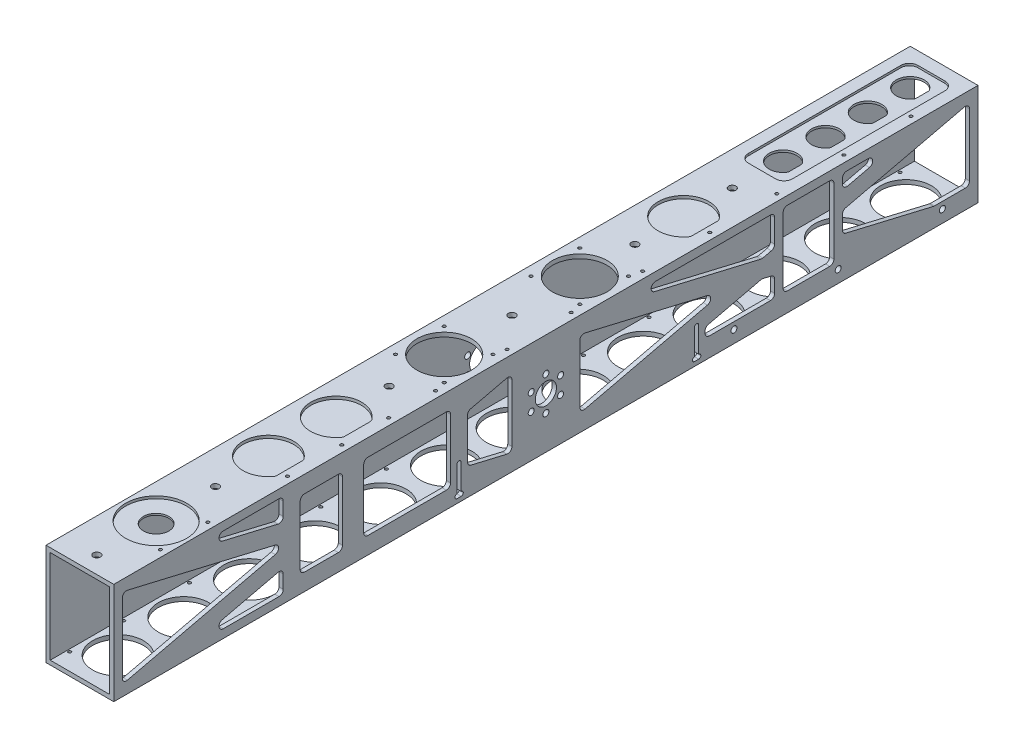
from build123d import *

# Parameters (mm, degrees)
SKETCH1_W                   = 50.8
SKETCH1_H                   = 76.2
SKETCH1_W_2                 = 44.45
SKETCH1_H_2                 = 69.85
BOSS_EXTRUDE1_DEPTH         = 647.7
CUT_EXTRUDE1_DEPTH          = 655.142469192
SKETCH4_R                   = 7.9375
CUT_EXTRUDE3_DEPTH          = 655.142469192
CUT_EXTRUDE4_REACH          = 656.142
SKETCH5_R                   = 9.525
F_8_CLEARANCE_HOLE1_D       = 4.4958
CIRPATTERN1_COUNT           = 6
SKETCH10_W                  = 57.15
SKETCH10_H                  = 76.2
BOSS_EXTRUDE2_DEPTH         = 3.175
CUT_EXTRUDE5_REACH          = 656.142
SKETCH12_R                  = 20.447
F_4_40_TAPPED_HOLE1_D       = 2.2606
F_4_40_TAPPED_HOLE1_DEPTH   = 3.175
CUT_EXTRUDE6_REACH          = 656.142
SKETCH17_W                  = 31.75
SKETCH17_H                  = 50.8
CUT_EXTRUDE7_REACH          = 656.142
LPATTERN1_COUNT             = 4
LPATTERN1_PITCH             = 31.75
CUT_EXTRUDE8_DEPTH          = 1.5875
F_1_4_28_TAPPED_HOLE2_D     = 5.4102
F_1_4_28_TAPPED_HOLE2_DEPTH = 3.175
CUT_EXTRUDE9_REACH          = 656.142
SKETCH23_R                  = 19.05
CUT_EXTRUDE10_REACH         = 656.142
SKETCH24_R                  = 19.05
BOSS_EXTRUDE3_DEPTH         = 3.175
BOSS_EXTRUDE6_DEPTH         = 3.175
CUT_EXTRUDE13_REACH         = 656.142
FILLET2_R                   = 1.5875
LPATTERN2_COUNT             = 2
LPATTERN2_PITCH             = 178.054
FILLET2_OF_LPATTERN2_R      = 1.5875
FILLET3_R                   = 3.175
SKETCH32_W                  = 204.5335
SKETCH32_H                  = 14.2875
BOSS_EXTRUDE7_DEPTH         = 3.175
FILLET4_R                   = 3.175
F_8_CLEARANCE_HOLE2_D       = 4.4958
F_8_CLEARANCE_HOLE2_DEPTH   = 3.175
SKETCH38_W                  = 254
SKETCH38_H                  = 14.2875
BOSS_EXTRUDE8_DEPTH         = 3.175
FILLET5_R                   = 3.175
F_8_CLEARANCE_HOLE3_D       = 4.4958
F_8_CLEARANCE_HOLE3_DEPTH   = 3.302
F_8_CLEARANCE_HOLE3_TIP     = 1.350674586
SKETCH41_W                  = 68.2625
SKETCH41_H                  = 76.2
BOSS_EXTRUDE9_DEPTH         = 3.175
CUT_EXTRUDE14_REACH         = 656.142
SKETCH43_W                  = 50.8
SKETCH43_H                  = 61.9125
BOSS_EXTRUDE10_DEPTH        = 3.175
FILLET6_R                   = 3.175
CUT_EXTRUDE15_REACH         = 656.142
SKETCH45_R                  = 19.05
BOSS_EXTRUDE12_DEPTH        = 3.175
SKETCH46_R                  = 22.86
CUT_EXTRUDE16_DEPTH         = 1.905
CUT_EXTRUDE17_REACH         = 655.923
SKETCH47_R                  = 9.525
BOSS_EXTRUDE13_DEPTH        = 1.016
F_4_40_TAPPED_HOLE2_D       = 2.2606
F_4_40_TAPPED_HOLE2_DEPTH   = 7.62
F_4_40_TAPPED_HOLE2_TIP     = 0.679152758
BOSS_EXTRUDE14_DEPTH        = 3.175
BOSS_EXTRUDE15_START        = -1.016
BOSS_EXTRUDE15_DEPTH        = 1.016
FILLET7_R                   = 3.175
F_4_40_TAPPED_HOLE3_D       = 2.2606
F_4_40_TAPPED_HOLE3_DEPTH   = 3.175


with BuildPart() as part:
    # Sketch1 → Boss-Extrude1 (new body)
    with BuildSketch(Plane.XY):
        with Locations((25.4, 38.1)):
            Rectangle(SKETCH1_W, SKETCH1_H)
        with Locations((25.4, 38.1)):
            Rectangle(SKETCH1_W_2, SKETCH1_H_2, mode=Mode.SUBTRACT)
    extrude(amount=BOSS_EXTRUDE1_DEPTH)

    # Sketch2 → Cut-Extrude1 (cut, through all)
    with BuildSketch(Plane(origin=(50.8, 0, 0), x_dir=(0, 0, -1), z_dir=(1, 0, 0))):
        with BuildLine():
            ThreePointArc((-566.359206485, 63.584400491), (-568.785835896, 67.041040679), (-565.632006601, 69.85))
            Line((-565.632006601, 69.85), (-405.917993399, 69.85))
            ThreePointArc((-405.917993399, 69.85), (-402.764164104, 67.041040679), (-405.190793515, 63.584400491))
            Line((-405.190793515, 63.584400491), (-485.047800115, 44.794516585))
            ThreePointArc((-485.047800115, 44.794516585), (-485.775, 44.710116094), (-486.502199885, 44.794516585))
            Line((-486.502199885, 44.794516585), (-566.359206485, 63.584400491))
        make_face()
        with BuildLine():
            Line((-637.447800115, 8.935693055), (-526.634543515, 35.009400491))
            ThreePointArc((-526.634543515, 35.009400491), (-524.186743399, 38.1), (-526.634543515, 41.190599509))
            Line((-526.634543515, 41.190599509), (-637.447800115, 67.264306945))
            ThreePointArc((-637.447800115, 67.264306945), (-640.146264235, 66.662631363), (-641.35, 64.173707435))
            Line((-641.35, 64.173707435), (-641.35, 12.026292565))
            ThreePointArc((-641.35, 12.026292565), (-640.146264235, 9.537368637), (-637.447800115, 8.935693055))
        make_face()
        with BuildLine():
            Line((-485.047800115, 31.405483415), (-405.190793515, 12.615599509))
            ThreePointArc((-405.190793515, 12.615599509), (-402.764164104, 9.158959321), (-405.917993399, 6.35))
            Line((-405.917993399, 6.35), (-565.632006601, 6.35))
            ThreePointArc((-565.632006601, 6.35), (-568.785835896, 9.158959321), (-566.359206485, 12.615599509))
            Line((-566.359206485, 12.615599509), (-486.502199885, 31.405483415))
            ThreePointArc((-486.502199885, 31.405483415), (-485.775, 31.489883906), (-485.047800115, 31.405483415))
        make_face()
        with BuildLine():
            ThreePointArc((-444.915456485, 35.009400491), (-447.363256601, 38.1), (-444.915456485, 41.190599509))
            Line((-444.915456485, 41.190599509), (-353.152199885, 62.781954004))
            ThreePointArc((-353.152199885, 62.781954004), (-350.453735765, 62.180278422), (-349.25, 59.691354494))
            Line((-349.25, 59.691354494), (-349.25, 16.508645506))
            ThreePointArc((-349.25, 16.508645506), (-350.453735765, 14.019721578), (-353.152199885, 13.418045996))
            Line((-353.152199885, 13.418045996), (-444.915456485, 35.009400491))
        make_face()
        with BuildLine():
            Line((-294.547800115, 62.781954004), (-202.784543515, 41.190599509))
            ThreePointArc((-202.784543515, 41.190599509), (-200.336743399, 38.1), (-202.784543515, 35.009400491))
            Line((-202.784543515, 35.009400491), (-294.547800115, 13.418045996))
            ThreePointArc((-294.547800115, 13.418045996), (-297.246264235, 14.019721578), (-298.45, 16.508645506))
            Line((-298.45, 16.508645506), (-298.45, 59.691354494))
            ThreePointArc((-298.45, 59.691354494), (-297.246264235, 62.180278422), (-294.547800115, 62.781954004))
        make_face()
        with BuildLine():
            ThreePointArc((-161.197800115, 44.794516585), (-161.925, 44.710116094), (-162.652199885, 44.794516585))
            Line((-162.652199885, 44.794516585), (-242.509206485, 63.584400491))
            ThreePointArc((-242.509206485, 63.584400491), (-244.935835896, 67.041040679), (-241.782006601, 69.85))
            Line((-241.782006601, 69.85), (-82.067993399, 69.85))
            ThreePointArc((-82.067993399, 69.85), (-78.914164104, 67.041040679), (-81.340793515, 63.584400491))
            Line((-81.340793515, 63.584400491), (-161.197800115, 44.794516585))
        make_face()
        with BuildLine():
            Line((-161.197800115, 31.405483415), (-81.340793515, 12.615599509))
            ThreePointArc((-81.340793515, 12.615599509), (-78.914164104, 9.158959321), (-82.067993399, 6.35))
            Line((-82.067993399, 6.35), (-241.782006601, 6.35))
            ThreePointArc((-241.782006601, 6.35), (-244.935835896, 9.158959321), (-242.509206485, 12.615599509))
            Line((-242.509206485, 12.615599509), (-162.652199885, 31.405483415))
            ThreePointArc((-162.652199885, 31.405483415), (-161.925, 31.489883906), (-161.197800115, 31.405483415))
        make_face()
        with BuildLine():
            Line((-121.065456485, 41.190599509), (-10.252199885, 67.264306945))
            ThreePointArc((-10.252199885, 67.264306945), (-7.553735765, 66.662631363), (-6.35, 64.173707435))
            Line((-6.35, 64.173707435), (-6.35, 12.026292565))
            ThreePointArc((-6.35, 12.026292565), (-7.553735765, 9.537368637), (-10.252199885, 8.935693055))
            Line((-10.252199885, 8.935693055), (-121.065456485, 35.009400491))
            ThreePointArc((-121.065456485, 35.009400491), (-123.513256601, 38.1), (-121.065456485, 41.190599509))
        make_face()
    extrude(amount=-CUT_EXTRUDE1_DEPTH, mode=Mode.SUBTRACT)

    # Sketch4 → Cut-Extrude3 (cut, through all)
    with BuildSketch(Plane(origin=(50.8, 0, 0), x_dir=(0, 0, -1), z_dir=(1, 0, 0))):
        with Locations((-323.85, 38.1)):
            Circle(SKETCH4_R)
    extrude(amount=-CUT_EXTRUDE3_DEPTH, mode=Mode.SUBTRACT)

    # Sketch5 → Cut-Extrude4 (cut, up to next)
    with BuildSketch(Plane.ZY, mode=Mode.PRIVATE) as cut_extrude4_sk1:
        with Locations((323.85, 38.1)):
            Circle(SKETCH5_R)
    cut_extrude4_tool1 = extrude(cut_extrude4_sk1.sketch, amount=-CUT_EXTRUDE4_REACH, mode=Mode.PRIVATE) & part.part
    add(cut_extrude4_tool1.solids().sort_by_distance((0, 38.1, 323.85))[0], mode=Mode.SUBTRACT)

    # #8 Clearance Hole1 (through all)
    with Locations(Plane.ZY):
        with Locations((323.85, 50.8)):
            f_8_clearance_hole1 = Hole(F_8_CLEARANCE_HOLE1_D / 2)

    # CirPattern1: #8 Clearance Hole1 ×6 about axis
    cirpattern1_axis = Axis((0, 38.1, 323.85), (1, 0, 0))
    for i in range(1, CIRPATTERN1_COUNT):
        add(f_8_clearance_hole1.rotate(cirpattern1_axis, i * 360 / CIRPATTERN1_COUNT), mode=Mode.SUBTRACT)

    # Sketch10 → Boss-Extrude2 (add)
    with BuildSketch(Plane(origin=(50.8, 0, 0), x_dir=(0, 0, -1), z_dir=(1, 0, 0))):
        with Locations((-492.125, 38.1)):
            Rectangle(SKETCH10_W, SKETCH10_H)
    extrude(amount=-BOSS_EXTRUDE2_DEPTH)

    # Sketch12 → Cut-Extrude5 (cut, up to next)
    with BuildSketch(Plane(origin=(0, 76.2, 0), x_dir=(1, 0, 0), z_dir=(0, 1, 0)), mode=Mode.PRIVATE) as cut_extrude5_sk1:
        with Locations(Location((25.4, -273.05, 0), (0, 0, 270))):
            Circle(SKETCH12_R)
    cut_extrude5_tool1 = extrude(cut_extrude5_sk1.sketch, amount=-CUT_EXTRUDE5_REACH, mode=Mode.PRIVATE) & part.part
    # Sketch12 → Cut-Extrude5 (cut, up to next)
    with BuildSketch(Plane(origin=(0, 76.2, 0), x_dir=(1, 0, 0), z_dir=(0, 1, 0)), mode=Mode.PRIVATE) as cut_extrude5_sk2:
        with Locations(Location((25.4, -374.65, 0), (0, 0, 270))):
            Circle(SKETCH12_R)
    cut_extrude5_tool2 = extrude(cut_extrude5_sk2.sketch, amount=-CUT_EXTRUDE5_REACH, mode=Mode.PRIVATE) & part.part
    add(cut_extrude5_tool1.solids().sort_by_distance((25.4, 76.2, 273.05))[0], mode=Mode.SUBTRACT)
    add(cut_extrude5_tool2.solids().sort_by_distance((25.4, 76.2, 374.65))[0], mode=Mode.SUBTRACT)

    # #4-40 Tapped Hole1
    with Locations(Plane(origin=(0, 76.2, 0), x_dir=(-1, 0, 0), z_dir=(0, 1, 0))):
        with Locations((-7.1374, 254.7874), (-43.6626, 254.7874), (-43.6626, 291.3126), (-7.1374, 291.3126), (-7.1374, 356.3874), (-43.6626, 356.3874), (-7.1374, 392.9126), (-43.6626, 392.9126)):
            Hole(F_4_40_TAPPED_HOLE1_D / 2, depth=F_4_40_TAPPED_HOLE1_DEPTH)

    # Sketch17 → Cut-Extrude6 (cut, up to next)
    with BuildSketch(Plane(origin=(50.8, 0, 0), x_dir=(0, 0, -1), z_dir=(1, 0, 0)), mode=Mode.PRIVATE) as cut_extrude6_sk1:
        with Locations((-492.125, 38.1)):
            Rectangle(SKETCH17_W, SKETCH17_H)
    cut_extrude6_tool1 = extrude(cut_extrude6_sk1.sketch, amount=-CUT_EXTRUDE6_REACH, mode=Mode.PRIVATE) & part.part
    add(cut_extrude6_tool1.solids().sort_by_distance((50.8, 38.1, 492.125))[0], mode=Mode.SUBTRACT)

    # Sketch18 → Cut-Extrude7 (cut, up to next)
    with BuildSketch(Plane(origin=(0, 76.2, 0), x_dir=(1, 0, 0), z_dir=(0, 1, 0)), mode=Mode.PRIVATE) as cut_extrude7_sk1:
        with BuildLine():
            Line((34.4043, -115.443309765), (34.4043, -125.856690235))
            ThreePointArc((34.4043, -125.856690235), (14.9987, -120.65), (34.4043, -115.443309765))
        make_face()
    cut_extrude7_tool1 = extrude(cut_extrude7_sk1.sketch, amount=-CUT_EXTRUDE7_REACH, mode=Mode.PRIVATE) & part.part
    cut_extrude7 = cut_extrude7_tool1.solids().sort_by_distance((25.114883, 76.2, 120.65))[0]
    add(cut_extrude7, mode=Mode.SUBTRACT)

    # LPattern1: Cut-Extrude7 ×4
    with Locations(*[(0, 0, -i * LPATTERN1_PITCH) for i in range(1, LPATTERN1_COUNT)]):
        add(cut_extrude7, mode=Mode.SUBTRACT)

    # Sketch19 → Cut-Extrude8 (cut)
    with BuildSketch(Plane(origin=(0, 76.2, 0), x_dir=(1, 0, 0), z_dir=(0, 1, 0))):
        with BuildLine():
            Line((15.24, -9.525), (35.56, -9.525))
            ThreePointArc((35.56, -9.525), (40.050128061, -11.384871939), (41.91, -15.875))
            Line((41.91, -15.875), (41.91, -130.175))
            ThreePointArc((41.91, -130.175), (40.050128061, -134.665128061), (35.56, -136.525))
            Line((35.56, -136.525), (15.24, -136.525))
            ThreePointArc((15.24, -136.525), (10.749871939, -134.665128061), (8.89, -130.175))
            Line((8.89, -130.175), (8.89, -15.875))
            ThreePointArc((8.89, -15.875), (10.749871939, -11.384871939), (15.24, -9.525))
        make_face()
    extrude(amount=-CUT_EXTRUDE8_DEPTH, mode=Mode.SUBTRACT)

    # 1/4-28 Tapped Hole2
    with Locations(Plane(origin=(0, 76.2, 0), x_dir=(-1, 0, 0), z_dir=(0, 1, 0))):
        with Locations((-25.4, 158.75), (-25.4, 231.775), (-25.4, 323.85), (-25.4, 415.925), (-25.4, 546.1), (-25.4, 635)):
            Hole(F_1_4_28_TAPPED_HOLE2_D / 2, depth=F_1_4_28_TAPPED_HOLE2_DEPTH)

    # Sketch23 → Cut-Extrude9 (cut, up to next)
    with BuildSketch(Plane(origin=(0, 76.2, 0), x_dir=(1, 0, 0), z_dir=(0, 1, 0)), mode=Mode.PRIVATE) as cut_extrude9_sk1:
        with Locations(Location((25.4, -195.2625, 0), (0, 0, 270))):
            Circle(SKETCH23_R)
    cut_extrude9_tool1 = extrude(cut_extrude9_sk1.sketch, amount=-CUT_EXTRUDE9_REACH, mode=Mode.PRIVATE) & part.part
    # Sketch23 → Cut-Extrude9 (cut, up to next)
    with BuildSketch(Plane(origin=(0, 76.2, 0), x_dir=(1, 0, 0), z_dir=(0, 1, 0)), mode=Mode.PRIVATE) as cut_extrude9_sk2:
        with Locations(Location((25.4, -455.6125, 0), (0, 0, 270))):
            Circle(SKETCH23_R)
    cut_extrude9_tool2 = extrude(cut_extrude9_sk2.sketch, amount=-CUT_EXTRUDE9_REACH, mode=Mode.PRIVATE) & part.part
    # Sketch23 → Cut-Extrude9 (cut, up to next)
    with BuildSketch(Plane(origin=(0, 76.2, 0), x_dir=(1, 0, 0), z_dir=(0, 1, 0)), mode=Mode.PRIVATE) as cut_extrude9_sk3:
        with Locations(Location((25.4, -506.4125, 0), (0, 0, 270))):
            Circle(SKETCH23_R)
    cut_extrude9_tool3 = extrude(cut_extrude9_sk3.sketch, amount=-CUT_EXTRUDE9_REACH, mode=Mode.PRIVATE) & part.part
    # Sketch23 → Cut-Extrude9 (cut, up to next)
    with BuildSketch(Plane(origin=(0, 76.2, 0), x_dir=(1, 0, 0), z_dir=(0, 1, 0)), mode=Mode.PRIVATE) as cut_extrude9_sk4:
        with Locations(Location((25.4, -590.55, 0), (0, 0, 270))):
            Circle(SKETCH23_R)
    cut_extrude9_tool4 = extrude(cut_extrude9_sk4.sketch, amount=-CUT_EXTRUDE9_REACH, mode=Mode.PRIVATE) & part.part
    add(cut_extrude9_tool1.solids().sort_by_distance((25.4, 76.2, 195.2625))[0], mode=Mode.SUBTRACT)
    add(cut_extrude9_tool2.solids().sort_by_distance((25.4, 76.2, 455.6125))[0], mode=Mode.SUBTRACT)
    add(cut_extrude9_tool3.solids().sort_by_distance((25.4, 76.2, 506.4125))[0], mode=Mode.SUBTRACT)
    add(cut_extrude9_tool4.solids().sort_by_distance((25.4, 76.2, 590.55))[0], mode=Mode.SUBTRACT)

    # Sketch24 → Cut-Extrude10 (cut, up to next)
    with BuildSketch(Plane.XZ, mode=Mode.PRIVATE) as cut_extrude10_sk1:
        with Locations(Location((25.4, 619.125, 0), (0, 0, 270))):
            Circle(SKETCH24_R)
    cut_extrude10_tool1 = extrude(cut_extrude10_sk1.sketch, amount=-CUT_EXTRUDE10_REACH, mode=Mode.PRIVATE) & part.part
    # Sketch24 → Cut-Extrude10 (cut, up to next)
    with BuildSketch(Plane.XZ, mode=Mode.PRIVATE) as cut_extrude10_sk2:
        with Locations(Location((25.4, 569.9125, 0), (0, 0, 270))):
            Circle(SKETCH24_R)
    cut_extrude10_tool2 = extrude(cut_extrude10_sk2.sketch, amount=-CUT_EXTRUDE10_REACH, mode=Mode.PRIVATE) & part.part
    # Sketch24 → Cut-Extrude10 (cut, up to next)
    with BuildSketch(Plane.XZ, mode=Mode.PRIVATE) as cut_extrude10_sk3:
        with Locations(Location((25.4, 520.7, 0), (0, 0, 270))):
            Circle(SKETCH24_R)
    cut_extrude10_tool3 = extrude(cut_extrude10_sk3.sketch, amount=-CUT_EXTRUDE10_REACH, mode=Mode.PRIVATE) & part.part
    # Sketch24 → Cut-Extrude10 (cut, up to next)
    with BuildSketch(Plane.XZ, mode=Mode.PRIVATE) as cut_extrude10_sk4:
        with Locations(Location((25.4, 471.4875, 0), (0, 0, 270))):
            Circle(SKETCH24_R)
    cut_extrude10_tool4 = extrude(cut_extrude10_sk4.sketch, amount=-CUT_EXTRUDE10_REACH, mode=Mode.PRIVATE) & part.part
    # Sketch24 → Cut-Extrude10 (cut, up to next)
    with BuildSketch(Plane.XZ, mode=Mode.PRIVATE) as cut_extrude10_sk5:
        with Locations(Location((25.4, 422.275, 0), (0, 0, 270))):
            Circle(SKETCH24_R)
    cut_extrude10_tool5 = extrude(cut_extrude10_sk5.sketch, amount=-CUT_EXTRUDE10_REACH, mode=Mode.PRIVATE) & part.part
    # Sketch24 → Cut-Extrude10 (cut, up to next)
    with BuildSketch(Plane.XZ, mode=Mode.PRIVATE) as cut_extrude10_sk6:
        with Locations(Location((25.4, 373.0625, 0), (0, 0, 270))):
            Circle(SKETCH24_R)
    cut_extrude10_tool6 = extrude(cut_extrude10_sk6.sketch, amount=-CUT_EXTRUDE10_REACH, mode=Mode.PRIVATE) & part.part
    # Sketch24 → Cut-Extrude10 (cut, up to next)
    with BuildSketch(Plane.XZ, mode=Mode.PRIVATE) as cut_extrude10_sk7:
        with Locations(Location((25.4, 323.85, 0), (0, 0, 270))):
            Circle(SKETCH24_R)
    cut_extrude10_tool7 = extrude(cut_extrude10_sk7.sketch, amount=-CUT_EXTRUDE10_REACH, mode=Mode.PRIVATE) & part.part
    # Sketch24 → Cut-Extrude10 (cut, up to next)
    with BuildSketch(Plane.XZ, mode=Mode.PRIVATE) as cut_extrude10_sk8:
        with Locations(Location((25.4, 274.6375, 0), (0, 0, 270))):
            Circle(SKETCH24_R)
    cut_extrude10_tool8 = extrude(cut_extrude10_sk8.sketch, amount=-CUT_EXTRUDE10_REACH, mode=Mode.PRIVATE) & part.part
    # Sketch24 → Cut-Extrude10 (cut, up to next)
    with BuildSketch(Plane.XZ, mode=Mode.PRIVATE) as cut_extrude10_sk9:
        with Locations(Location((25.4, 225.425, 0), (0, 0, 270))):
            Circle(SKETCH24_R)
    cut_extrude10_tool9 = extrude(cut_extrude10_sk9.sketch, amount=-CUT_EXTRUDE10_REACH, mode=Mode.PRIVATE) & part.part
    # Sketch24 → Cut-Extrude10 (cut, up to next)
    with BuildSketch(Plane.XZ, mode=Mode.PRIVATE) as cut_extrude10_sk10:
        with Locations(Location((25.4, 176.2125, 0), (0, 0, 270))):
            Circle(SKETCH24_R)
    cut_extrude10_tool10 = extrude(cut_extrude10_sk10.sketch, amount=-CUT_EXTRUDE10_REACH, mode=Mode.PRIVATE) & part.part
    # Sketch24 → Cut-Extrude10 (cut, up to next)
    with BuildSketch(Plane.XZ, mode=Mode.PRIVATE) as cut_extrude10_sk11:
        with Locations(Location((25.4, 127, 0), (0, 0, 270))):
            Circle(SKETCH24_R)
    cut_extrude10_tool11 = extrude(cut_extrude10_sk11.sketch, amount=-CUT_EXTRUDE10_REACH, mode=Mode.PRIVATE) & part.part
    # Sketch24 → Cut-Extrude10 (cut, up to next)
    with BuildSketch(Plane.XZ, mode=Mode.PRIVATE) as cut_extrude10_sk12:
        with Locations(Location((25.4, 77.7875, 0), (0, 0, 270))):
            Circle(SKETCH24_R)
    cut_extrude10_tool12 = extrude(cut_extrude10_sk12.sketch, amount=-CUT_EXTRUDE10_REACH, mode=Mode.PRIVATE) & part.part
    # Sketch24 → Cut-Extrude10 (cut, up to next)
    with BuildSketch(Plane.XZ, mode=Mode.PRIVATE) as cut_extrude10_sk13:
        with Locations(Location((25.4, 28.575, 0), (0, 0, 270))):
            Circle(SKETCH24_R)
    cut_extrude10_tool13 = extrude(cut_extrude10_sk13.sketch, amount=-CUT_EXTRUDE10_REACH, mode=Mode.PRIVATE) & part.part
    add(cut_extrude10_tool1.solids().sort_by_distance((25.4, 0, 619.125))[0], mode=Mode.SUBTRACT)
    add(cut_extrude10_tool2.solids().sort_by_distance((25.4, 0, 569.9125))[0], mode=Mode.SUBTRACT)
    add(cut_extrude10_tool3.solids().sort_by_distance((25.4, 0, 520.7))[0], mode=Mode.SUBTRACT)
    add(cut_extrude10_tool4.solids().sort_by_distance((25.4, 0, 471.4875))[0], mode=Mode.SUBTRACT)
    add(cut_extrude10_tool5.solids().sort_by_distance((25.4, 0, 422.275))[0], mode=Mode.SUBTRACT)
    add(cut_extrude10_tool6.solids().sort_by_distance((25.4, 0, 373.0625))[0], mode=Mode.SUBTRACT)
    add(cut_extrude10_tool7.solids().sort_by_distance((25.4, 0, 323.85))[0], mode=Mode.SUBTRACT)
    add(cut_extrude10_tool8.solids().sort_by_distance((25.4, 0, 274.6375))[0], mode=Mode.SUBTRACT)
    add(cut_extrude10_tool9.solids().sort_by_distance((25.4, 0, 225.425))[0], mode=Mode.SUBTRACT)
    add(cut_extrude10_tool10.solids().sort_by_distance((25.4, 0, 176.2125))[0], mode=Mode.SUBTRACT)
    add(cut_extrude10_tool11.solids().sort_by_distance((25.4, 0, 127))[0], mode=Mode.SUBTRACT)
    add(cut_extrude10_tool12.solids().sort_by_distance((25.4, 0, 77.7875))[0], mode=Mode.SUBTRACT)
    add(cut_extrude10_tool13.solids().sort_by_distance((25.4, 0, 28.575))[0], mode=Mode.SUBTRACT)

    # Sketch25 → Boss-Extrude3 (add)
    with BuildSketch(Plane(origin=(50.8, 0, 0), x_dir=(0, 0, -1), z_dir=(1, 0, 0))):
        Polygon((-395.2875, 52.867765741), (-395.2875, 23.332234259), (-382.5875, 20.343998965), (-382.5875, 55.856001035), align=None)
    extrude(amount=-BOSS_EXTRUDE3_DEPTH)

    # Sketch28 → Boss-Extrude6 (add)
    with BuildSketch(Plane(origin=(50.8, 0, 0), x_dir=(0, 0, -1), z_dir=(1, 0, 0))):
        with BuildLine():
            Line((-242.509206485, 12.615599509), (-204.5335, 21.551059859))
            Line((-204.5335, 21.551059859), (-204.5335, 6.35))
            Line((-204.5335, 6.35), (-241.782006601, 6.35))
            ThreePointArc((-241.782006601, 6.35), (-244.935835896, 9.158959321), (-242.509206485, 12.615599509))
        make_face()
    extrude(amount=-BOSS_EXTRUDE6_DEPTH)

    # Sketch31 → Cut-Extrude13 (cut, up to next)
    with BuildSketch(Plane(origin=(50.8, 0, 0), x_dir=(0, 0, -1), z_dir=(1, 0, 0)), mode=Mode.PRIVATE) as cut_extrude13_sk1:
        Polygon((-390.525, 26.9875), (-390.525, 6.35), (-392.1125, 6.35), (-392.1125, 3.175), (-385.7625, 3.175), (-385.7625, 6.35), (-387.35, 6.35), (-387.35, 26.9875), align=None)
    cut_extrude13_tool1 = extrude(cut_extrude13_sk1.sketch, amount=-CUT_EXTRUDE13_REACH, mode=Mode.PRIVATE) & part.part
    cut_extrude13 = cut_extrude13_tool1.solids().sort_by_distance((50.8, 13.867279, 388.9375))[0]
    add(cut_extrude13, mode=Mode.SUBTRACT)

    # Fillet2
    fillet2_edges = [part.edges().sort_by_distance(p)[0] for p in [
        (49.2125, 26.9875, 387.35),
        (49.2125, 26.9875, 390.525),
        (49.2125, 6.35, 385.7625),
        (49.2125, 3.175, 385.7625),
        (49.2125, 3.175, 392.1125),
        (49.2125, 6.35, 392.1125),
    ]]
    fillet(fillet2_edges, radius=FILLET2_R - 0.0001)  # a hair under: the kernel refuses the full size

    # LPattern2: Cut-Extrude13 ×2
    with Locations(*[(0, 0, -i * LPATTERN2_PITCH) for i in range(1, LPATTERN2_COUNT)]):
        add(cut_extrude13, mode=Mode.SUBTRACT)

    # Fillet2 of LPattern2
    fillet2_of_lpattern2_edges = [part.edges().sort_by_distance(p)[0] for p in [
        (49.2125, 26.9875, 209.296),
        (49.2125, 26.9875, 212.471),
        (49.2125, 6.35, 207.7085),
        (49.2125, 3.175, 207.7085),
        (49.2125, 3.175, 214.0585),
        (49.2125, 6.35, 214.0585),
    ]]
    fillet(fillet2_of_lpattern2_edges, radius=FILLET2_OF_LPATTERN2_R - 0.0001)  # a hair under: the kernel refuses the full size

    # Fillet3
    fillet3_edges = [part.edges().sort_by_distance(p)[0] for p in [
        (49.2125, 23.358942212, 520.7),
        (49.2125, 6.35, 463.55),
        (49.2125, 69.85, 463.55),
        (49.2125, 49.852822494, 463.55),
        (49.2125, 26.347177506, 463.55),
        (49.2125, 69.85, 520.7),
        (49.2125, 52.841057788, 520.7),
        (49.2125, 6.35, 520.7),
        (49.2125, 63.5, 508),
        (49.2125, 12.7, 508),
        (49.2125, 12.7, 476.25),
        (49.2125, 63.5, 476.25),
        (49.2125, 23.332234259, 395.2875),
        (49.2125, 20.343998965, 382.5875),
        (49.2125, 55.856001035, 382.5875),
        (49.2125, 52.867765741, 395.2875),
        (49.2125, 6.35, 204.5335),
        (49.2125, 21.551059859, 204.5335),
    ]]
    fillet(fillet3_edges, radius=FILLET3_R)

    # Sketch32 → Boss-Extrude7 (add)
    with BuildSketch(Plane(origin=(50.8, 0, 0), x_dir=(0, 0, -1), z_dir=(1, 0, 0))):
        with Locations((-102.26675, 7.14375)):
            Rectangle(SKETCH32_W, SKETCH32_H)
    extrude(amount=-BOSS_EXTRUDE7_DEPTH)

    # Fillet4
    fillet4_edges = [part.edges().sort_by_distance(p)[0] for p in [
        (49.2125, 14.2875, 88.4463706),
        (49.2125, 14.2875, 204.5335),
        (49.2125, 14.2875, 32.9973794),
        (49.2125, 14.2875, 6.35),
    ]]
    fillet(fillet4_edges, radius=FILLET4_R)

    # #8 Clearance Hole2
    with Locations(Plane(origin=(50.8, 0, 0), x_dir=(0, 0, -1), z_dir=(1, 0, 0))):
        with Locations((-26.67, 9.2075), (-104.775, 9.2075), (-182.88, 9.2075)):
            Hole(F_8_CLEARANCE_HOLE2_D / 2, depth=F_8_CLEARANCE_HOLE2_DEPTH)

    # Sketch38 → Boss-Extrude8 (add)
    with BuildSketch(Plane.ZY):
        with Locations((127, 7.14375)):
            Rectangle(SKETCH38_W, SKETCH38_H)
    extrude(amount=-BOSS_EXTRUDE8_DEPTH)

    # Fillet5
    fillet5_edges = [part.edges().sort_by_distance(p)[0] for p in [
        (1.5875, 14.2875, 6.35),
        (1.5875, 14.2875, 32.9973794),
        (1.5875, 14.2875, 235.4036294),
        (1.5875, 14.2875, 88.4463706),
    ]]
    fillet(fillet5_edges, radius=FILLET5_R)

    # #8 Clearance Hole3
    with Locations(Plane(origin=(3.175, 0, 0), x_dir=(0, 0, -1), z_dir=(1, 0, 0))):
        with Locations((-104.775, 9.2075), (-26.67, 9.2075), (-182.88, 9.2075)):
            Hole(F_8_CLEARANCE_HOLE3_D / 2, depth=F_8_CLEARANCE_HOLE3_DEPTH)
            with Locations((0, 0, -(F_8_CLEARANCE_HOLE3_DEPTH + F_8_CLEARANCE_HOLE3_TIP / 2))):  # 118° drill point
                Cone(0, F_8_CLEARANCE_HOLE3_D / 2, F_8_CLEARANCE_HOLE3_TIP, mode=Mode.SUBTRACT)

    # Sketch41 → Boss-Extrude9 (add)
    with BuildSketch(Plane(origin=(50.8, 0, 0), x_dir=(0, 0, -1), z_dir=(1, 0, 0))):
        with Locations((-429.41875, 38.1)):
            Rectangle(SKETCH41_W, SKETCH41_H)
    extrude(amount=-BOSS_EXTRUDE9_DEPTH)

    # Sketch42 → Cut-Extrude14 (cut, up to next)
    with BuildSketch(Plane(origin=(50.8, 0, 0), x_dir=(0, 0, -1), z_dir=(1, 0, 0)), mode=Mode.PRIVATE) as cut_extrude14_sk1:
        with BuildLine():
            Line((-457.2, 63.5), (-398.4625, 63.5))
            ThreePointArc((-398.4625, 63.5), (-396.21743597, 62.57006403), (-395.2875, 60.325))
            Line((-395.2875, 60.325), (-395.2875, 15.875))
            ThreePointArc((-395.2875, 15.875), (-396.21743597, 13.62993597), (-398.4625, 12.7))
            Line((-398.4625, 12.7), (-457.2, 12.7))
            ThreePointArc((-457.2, 12.7), (-459.44506403, 13.62993597), (-460.375, 15.875))
            Line((-460.375, 15.875), (-460.375, 60.325))
            ThreePointArc((-460.375, 60.325), (-459.44506403, 62.57006403), (-457.2, 63.5))
        make_face()
    cut_extrude14_tool1 = extrude(cut_extrude14_sk1.sketch, amount=-CUT_EXTRUDE14_REACH, mode=Mode.PRIVATE) & part.part
    add(cut_extrude14_tool1.solids().sort_by_distance((50.8, 38.1, 427.83125))[0], mode=Mode.SUBTRACT)

    # Sketch43 → Boss-Extrude10 (add)
    with BuildSketch(Plane(origin=(50.8, 0, 0), x_dir=(0, 0, -1), z_dir=(1, 0, 0))):
        with Locations((-127, 45.24375)):
            Rectangle(SKETCH43_W, SKETCH43_H)
    extrude(amount=-BOSS_EXTRUDE10_DEPTH)

    # Fillet6
    fillet6_edges = [part.edges().sort_by_distance(p)[0] for p in [
        (49.2125, 30.429293082, 101.6),
        (49.2125, 69.85, 101.6),
        (49.2125, 58.817528376, 101.6),
        (49.2125, 45.770706918, 101.6),
        (49.2125, 69.85, 152.4),
        (49.2125, 46.8645872, 152.4),
        (49.2125, 29.3354128, 152.4),
        (49.2125, 14.2875, 152.4),
    ]]
    fillet(fillet6_edges, radius=FILLET6_R)

    # Sketch44 → Cut-Extrude15 (cut, up to next)
    with BuildSketch(Plane(origin=(50.8, 0, 0), x_dir=(0, 0, -1), z_dir=(1, 0, 0)), mode=Mode.PRIVATE) as cut_extrude15_sk1:
        with BuildLine():
            Line((-142.875, 69.85), (-111.125, 69.85))
            ThreePointArc((-111.125, 69.85), (-108.87993597, 68.92006403), (-107.95, 66.675))
            Line((-107.95, 66.675), (-107.95, 17.4625))
            ThreePointArc((-107.95, 17.4625), (-108.87993597, 15.21743597), (-111.125, 14.2875))
            Line((-111.125, 14.2875), (-142.875, 14.2875))
            ThreePointArc((-142.875, 14.2875), (-145.12006403, 15.21743597), (-146.05, 17.4625))
            Line((-146.05, 17.4625), (-146.05, 66.675))
            ThreePointArc((-146.05, 66.675), (-145.12006403, 68.92006403), (-142.875, 69.85))
        make_face()
    cut_extrude15_tool1 = extrude(cut_extrude15_sk1.sketch, amount=-CUT_EXTRUDE15_REACH, mode=Mode.PRIVATE) & part.part
    add(cut_extrude15_tool1.solids().sort_by_distance((50.8, 42.06875, 127))[0], mode=Mode.SUBTRACT)

    # Sketch45 → Boss-Extrude12 (add)
    with BuildSketch(Plane(origin=(0, 76.2, 0), x_dir=(1, 0, 0), z_dir=(0, 1, 0))):
        with Locations((25.4, -590.55)):
            Circle(SKETCH45_R)
    extrude(amount=-BOSS_EXTRUDE12_DEPTH)

    # Sketch46 → Cut-Extrude16 (cut)
    with BuildSketch(Plane(origin=(0, 76.2, 0), x_dir=(1, 0, 0), z_dir=(0, 1, 0))):
        with Locations(Location((25.4, -590.55, 0), (0, 0, 270))):
            Circle(SKETCH46_R)
    extrude(amount=-CUT_EXTRUDE16_DEPTH, mode=Mode.SUBTRACT)

    # Sketch47 → Cut-Extrude17 (cut, up to next)
    with BuildSketch(Plane(origin=(0, 74.295, 0), x_dir=(1, 0, 0), z_dir=(0, 1, 0)), mode=Mode.PRIVATE) as cut_extrude17_sk1:
        with Locations(Location((25.4, -590.55, 0), (0, 0, 270))):
            Circle(SKETCH47_R)
    cut_extrude17_tool1 = extrude(cut_extrude17_sk1.sketch, amount=-CUT_EXTRUDE17_REACH, mode=Mode.PRIVATE) & part.part
    add(cut_extrude17_tool1.solids().sort_by_distance((25.4, 74.295, 590.55))[0], mode=Mode.SUBTRACT)

    # Sketch48 → Boss-Extrude13 (add)
    with BuildSketch(Plane(origin=(3.175, 0, 0), x_dir=(0, 0, -1), z_dir=(1, 0, 0))):
        with BuildLine():
            Line((-566.359206485, 63.584400491), (-486.502199885, 44.794516585))
            ThreePointArc((-486.502199885, 44.794516585), (-485.775, 44.710116094), (-485.047800115, 44.794516585))
            Line((-485.047800115, 44.794516585), (-405.190793515, 63.584400491))
            ThreePointArc((-405.190793515, 63.584400491), (-402.764164104, 67.041040679), (-405.917993399, 69.85))
            Line((-405.917993399, 69.85), (-565.632006601, 69.85))
            ThreePointArc((-565.632006601, 69.85), (-568.785835896, 67.041040679), (-566.359206485, 63.584400491))
        make_face()
        with BuildLine():
            Line((-444.915456485, 35.009400491), (-353.152199885, 13.418045996))
            ThreePointArc((-353.152199885, 13.418045996), (-350.453735765, 14.019721578), (-349.25, 16.508645506))
            Line((-349.25, 16.508645506), (-349.25, 59.691354494))
            ThreePointArc((-349.25, 59.691354494), (-350.453735765, 62.180278422), (-353.152199885, 62.781954004))
            Line((-353.152199885, 62.781954004), (-444.915456485, 41.190599509))
            ThreePointArc((-444.915456485, 41.190599509), (-447.363256601, 38.1), (-444.915456485, 35.009400491))
        make_face()
        with BuildLine():
            Line((-486.502199885, 31.405483415), (-566.359206485, 12.615599509))
            ThreePointArc((-566.359206485, 12.615599509), (-568.785835896, 9.158959321), (-565.632006601, 6.35))
            Line((-565.632006601, 6.35), (-405.917993399, 6.35))
            ThreePointArc((-405.917993399, 6.35), (-402.764164104, 9.158959321), (-405.190793515, 12.615599509))
            Line((-405.190793515, 12.615599509), (-485.047800115, 31.405483415))
            ThreePointArc((-485.047800115, 31.405483415), (-485.775, 31.489883906), (-486.502199885, 31.405483415))
        make_face()
        with BuildLine():
            Line((-637.447800115, 8.935693055), (-526.634543515, 35.009400491))
            ThreePointArc((-526.634543515, 35.009400491), (-524.186743399, 38.1), (-526.634543515, 41.190599509))
            Line((-526.634543515, 41.190599509), (-637.447800115, 67.264306945))
            ThreePointArc((-637.447800115, 67.264306945), (-640.146264235, 66.662631363), (-641.35, 64.173707435))
            Line((-641.35, 64.173707435), (-641.35, 12.026292565))
            ThreePointArc((-641.35, 12.026292565), (-640.146264235, 9.537368637), (-637.447800115, 8.935693055))
        make_face()
        with BuildLine():
            Line((-298.45, 59.691354494), (-298.45, 16.508645506))
            ThreePointArc((-298.45, 16.508645506), (-297.246264235, 14.019721578), (-294.547800115, 13.418045996))
            Line((-294.547800115, 13.418045996), (-202.784543515, 35.009400491))
            ThreePointArc((-202.784543515, 35.009400491), (-200.336743399, 38.1), (-202.784543515, 41.190599509))
            Line((-202.784543515, 41.190599509), (-294.547800115, 62.781954004))
            ThreePointArc((-294.547800115, 62.781954004), (-297.246264235, 62.180278422), (-298.45, 59.691354494))
        make_face()
        with BuildLine():
            Line((-161.197800115, 44.794516585), (-81.340793515, 63.584400491))
            ThreePointArc((-81.340793515, 63.584400491), (-78.914164104, 67.041040679), (-82.067993399, 69.85))
            Line((-82.067993399, 69.85), (-241.782006601, 69.85))
            ThreePointArc((-241.782006601, 69.85), (-244.935835896, 67.041040679), (-242.509206485, 63.584400491))
            Line((-242.509206485, 63.584400491), (-162.652199885, 44.794516585))
            ThreePointArc((-162.652199885, 44.794516585), (-161.925, 44.710116094), (-161.197800115, 44.794516585))
        make_face()
        with BuildLine():
            Line((-115.075168515, 20.553099509), (-161.197800115, 31.405483415))
            ThreePointArc((-161.197800115, 31.405483415), (-161.925, 31.489883906), (-162.652199885, 31.405483415))
            Line((-162.652199885, 31.405483415), (-208.774831485, 20.553099509))
            ThreePointArc((-208.774831485, 20.553099509), (-211.201460896, 17.096459321), (-208.047631601, 14.2875))
            Line((-208.047631601, 14.2875), (-115.802368399, 14.2875))
            ThreePointArc((-115.802368399, 14.2875), (-112.648539104, 17.096459321), (-115.075168515, 20.553099509))
        make_face()
        with BuildLine():
            Line((-6.35, 17.4625), (-6.35, 64.173707435))
            ThreePointArc((-6.35, 64.173707435), (-7.553735765, 66.662631363), (-10.252199885, 67.264306945))
            Line((-10.252199885, 67.264306945), (-121.065456485, 41.190599509))
            ThreePointArc((-121.065456485, 41.190599509), (-123.513256601, 38.1), (-121.065456485, 35.009400491))
            Line((-121.065456485, 35.009400491), (-33.356081485, 14.371900491))
            ThreePointArc((-33.356081485, 14.371900491), (-32.99492228, 14.308670705), (-32.628881601, 14.2875))
            Line((-32.628881601, 14.2875), (-9.525, 14.2875))
            ThreePointArc((-9.525, 14.2875), (-7.27993597, 15.21743597), (-6.35, 17.4625))
        make_face()
    extrude(amount=-BOSS_EXTRUDE13_DEPTH)

    # #4-40 Tapped Hole2
    with Locations(Plane.XZ):
        with Locations((5.08, 635), (5.08, 594.51875), (5.08, 545.30625), (5.08, 496.09375), (5.08, 446.88125), (5.08, 397.66875), (5.08, 348.45625), (5.08, 299.24375), (5.08, 250.03125), (5.08, 200.81875), (5.08, 151.60625), (5.08, 102.39375), (5.08, 53.18125), (5.08, 12.7)):
            Hole(F_4_40_TAPPED_HOLE2_D / 2, depth=F_4_40_TAPPED_HOLE2_DEPTH)
            with Locations((0, 0, -(F_4_40_TAPPED_HOLE2_DEPTH + F_4_40_TAPPED_HOLE2_TIP / 2))):  # 118° drill point
                Cone(0, F_4_40_TAPPED_HOLE2_D / 2, F_4_40_TAPPED_HOLE2_TIP, mode=Mode.SUBTRACT)

    # Sketch51 → Boss-Extrude14 (add)
    with BuildSketch(Plane(origin=(0, 76.2, 0), x_dir=(1, 0, 0), z_dir=(0, 1, 0))):
        with BuildLine():
            Line((41.275, -184.732216291), (41.275, -205.792783709))
            ThreePointArc((41.275, -205.792783709), (44.45, -195.2625), (41.275, -184.732216291))
        make_face()
        with BuildLine():
            Line((41.275, -445.082216291), (41.275, -466.142783709))
            ThreePointArc((41.275, -466.142783709), (44.45, -455.6125), (41.275, -445.082216291))
        make_face()
        with BuildLine():
            Line((41.275, -495.882216291), (41.275, -516.942783709))
            ThreePointArc((41.275, -516.942783709), (44.45, -506.4125), (41.275, -495.882216291))
        make_face()
    extrude(amount=-BOSS_EXTRUDE14_DEPTH)

    # Sketch52 → Boss-Extrude15 (add)
    with BuildSketch(Plane.XZ.offset(-73.025).offset(BOSS_EXTRUDE15_START)):
        with BuildLine():
            Line((41.275, 495.882216291), (41.275, 516.942783709))
            ThreePointArc((41.275, 516.942783709), (6.35, 506.4125), (41.275, 495.882216291))
        make_face()
        with BuildLine():
            Line((41.275, 445.082216291), (41.275, 466.142783709))
            ThreePointArc((41.275, 466.142783709), (6.35, 455.6125), (41.275, 445.082216291))
        make_face()
        with BuildLine():
            Line((41.275, 184.732216291), (41.275, 205.792783709))
            ThreePointArc((41.275, 205.792783709), (6.35, 195.2625), (41.275, 184.732216291))
        make_face()
    extrude(amount=BOSS_EXTRUDE15_DEPTH)

    # Fillet7
    fillet7_edges = [part.edges().sort_by_distance(p)[0] for p in [
        (41.275, 75.1205, 495.882216291),
        (41.275, 75.1205, 516.942783709),
        (41.275, 75.1205, 445.082216291),
        (41.275, 75.1205, 466.142783709),
        (41.275, 75.1205, 184.732216291),
        (41.275, 75.1205, 205.792783709),
        (34.4043, 73.81875, 115.443309765),
        (34.4043, 73.81875, 125.856690235),
        (34.4043, 73.81875, 83.693309765),
        (34.4043, 73.81875, 94.106690235),
        (34.4043, 73.81875, 62.356690235),
        (34.4043, 73.81875, 51.943309765),
        (34.4043, 73.81875, 30.606690235),
        (34.4043, 73.81875, 20.193309765),
    ]]
    fillet(fillet7_edges, radius=FILLET7_R)

    # #4-40 Tapped Hole3
    with Locations(Plane(origin=(0, 76.2, 0), x_dir=(-1, 0, 0), z_dir=(0, 1, 0))):
        with Locations((-45.72, 45.1866), (-45.72, 95.4532), (-45.72, 145.7198), (-45.72, 195.9864), (-45.72, 246.253), (-45.72, 299.847), (-45.72, 347.853), (-45.72, 401.447), (-45.72, 436.626), (-45.72, 471.805), (-45.72, 512.445), (-45.72, 572.135), (-45.72, 607.695)):
            Hole(F_4_40_TAPPED_HOLE3_D / 2, depth=F_4_40_TAPPED_HOLE3_DEPTH)


solid = part.part
